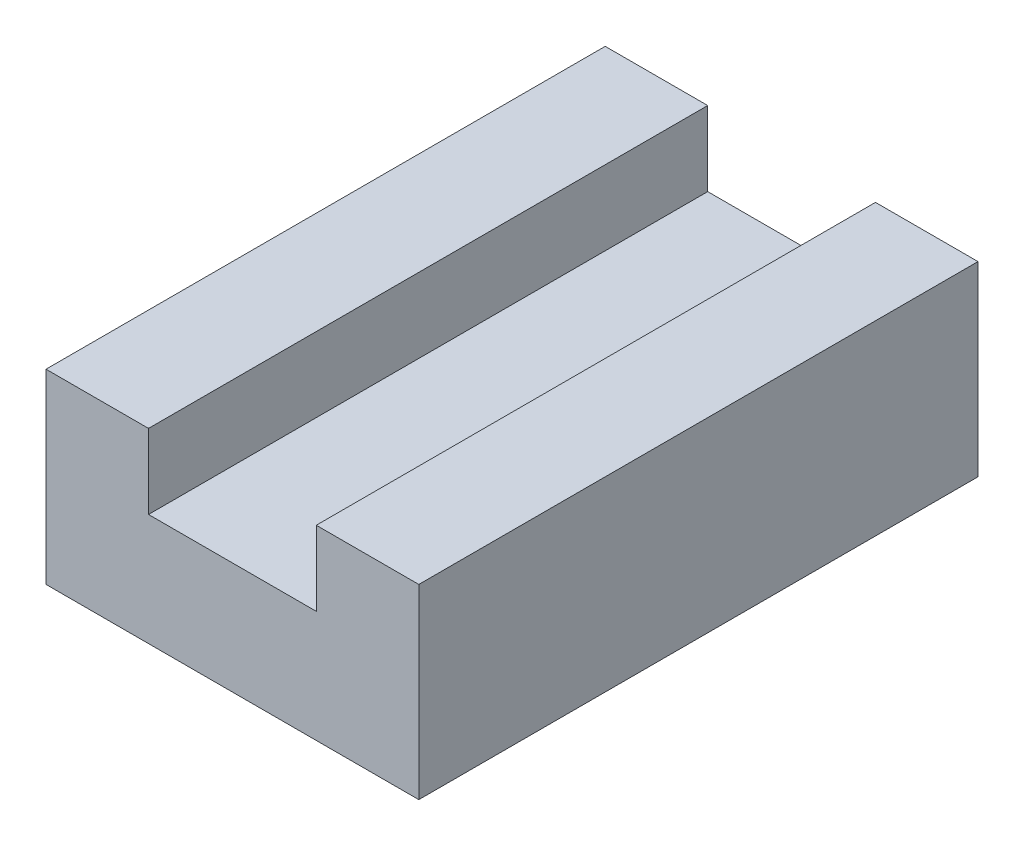
from build123d import *

# Parameters (mm, degrees)
SKETCH1_W           = 20
SKETCH1_H           = 30
BOSS_EXTRUDE1_DEPTH = 10
SKETCH2_W           = 9
SKETCH2_H           = 4
CUT_EXTRUDE1_DEPTH  = 38.416573868
SKETCH3_R           = 1.5
CUT_EXTRUDE2_DEPTH  = 5


with BuildPart() as part:
    # Sketch1 → Boss-Extrude1 (new body)
    with BuildSketch(Plane(origin=(0, 0, 0), x_dir=(1, 0, 0), z_dir=(0, 1, 0))):
        with Locations((10, 15)):
            Rectangle(SKETCH1_W, SKETCH1_H)
    extrude(amount=BOSS_EXTRUDE1_DEPTH)

    # Sketch2 → Cut-Extrude1 (cut, through all)
    with BuildSketch(Plane.XY):
        with Locations((10, 8)):
            Rectangle(SKETCH2_W, SKETCH2_H)
    extrude(amount=-CUT_EXTRUDE1_DEPTH, mode=Mode.SUBTRACT)

    # Sketch3 → Cut-Extrude2 (cut)
    with BuildSketch(Plane.XZ):
        with Locations((2.5, -19.682120583)):
            Circle(SKETCH3_R)
        with Locations((17.5, -19.682120583)):
            Circle(SKETCH3_R)
        with Locations((17.5, -9.682120583)):
            Circle(SKETCH3_R)
        with Locations((2.5, -9.682120583)):
            Circle(SKETCH3_R)
    extrude(amount=-CUT_EXTRUDE2_DEPTH, mode=Mode.SUBTRACT)


solid = part.part
